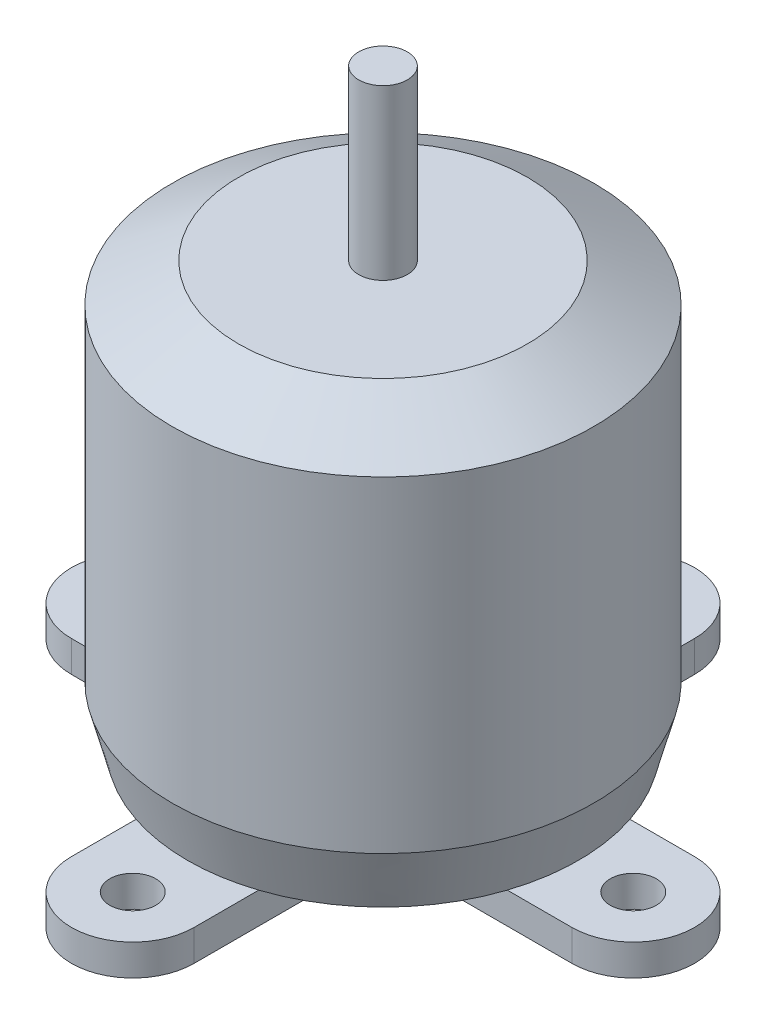
from build123d import *

# Parameters (mm, degrees)
SKETCH1_R           = 13.75
BOSS_EXTRUDE1_DEPTH = 27.5
SKETCH3_R           = 1.585
BOSS_EXTRUDE2_DEPTH = 11
CHAMFER1_SIZE       = 2.5
CHAMFER1_SIZE2      = 4.330127019
CHAMFER2_SIZE       = 1
CHAMFER2_SIZE2      = 3.732050808
SKETCH4_R           = 1.5
BOSS_EXTRUDE3_DEPTH = 2.032


with BuildPart() as part:
    # Sketch1 → Boss-Extrude1 (new body)
    with BuildSketch(Plane(origin=(0, 0, 0), x_dir=(1, 0, 0), z_dir=(0, 1, 0))):
        Circle(SKETCH1_R)
    extrude(amount=BOSS_EXTRUDE1_DEPTH)

    # Sketch3 → Boss-Extrude2 (add)
    with BuildSketch(Plane(origin=(0, 27.5, 0), x_dir=(1, 0, 0), z_dir=(0, 1, 0))):
        Circle(SKETCH3_R)
    extrude(amount=BOSS_EXTRUDE2_DEPTH)

    # Chamfer1
    chamfer1_edges = [part.edges().sort_by_distance(p)[0] for p in [
        (-13.75, 27.5, 0),
    ]]
    chamfer1_side = [part.faces().sort_by_distance(p)[0] for p in [
        (-13.75, 13.75, 0),
    ]]
    chamfer(chamfer1_edges, length=CHAMFER1_SIZE, length2=CHAMFER1_SIZE2, reference=chamfer1_side[0])

    # Chamfer2
    chamfer2_edges = [part.edges().sort_by_distance(p)[0] for p in [
        (-13.75, 0, 0),
    ]]
    chamfer2_side = [part.faces().sort_by_distance(p)[0] for p in [
        (0, 0, 0),
    ]]
    chamfer(chamfer2_edges, length=CHAMFER2_SIZE, length2=CHAMFER2_SIZE2, reference=chamfer2_side[0])

    # Sketch4 → Boss-Extrude3 (add)
    with BuildSketch(Plane.XZ):
        with BuildLine():
            Line((4, 16.32), (4, 9))
            ThreePointArc((4, 9), (5.464466094, 5.464466094), (9, 4))
            Line((9, 4), (16.32, 4))
            ThreePointArc((16.32, 4), (20.32, 0), (16.32, -4))
            Line((16.32, -4), (9, -4))
            ThreePointArc((9, -4), (5.464466094, -5.464466094), (4, -9))
            Line((4, -9), (4, -16.32))
            ThreePointArc((4, -16.32), (0, -20.32), (-4, -16.32))
            Line((-4, -16.32), (-4, -9))
            ThreePointArc((-4, -9), (-5.464466094, -5.464466094), (-9, -4))
            Line((-9, -4), (-16.32, -4))
            ThreePointArc((-16.32, -4), (-20.32, 0), (-16.32, 4))
            Line((-16.32, 4), (-9, 4))
            ThreePointArc((-9, 4), (-5.464466094, 5.464466094), (-4, 9))
            Line((-4, 9), (-4, 16.32))
            ThreePointArc((-4, 16.32), (0, 20.32), (4, 16.32))
        make_face()
        with Locations((0, 16.32)):
            Circle(SKETCH4_R, mode=Mode.SUBTRACT)
        with Locations((16.32, 0)):
            Circle(SKETCH4_R, mode=Mode.SUBTRACT)
        with Locations((0, -16.32)):
            Circle(SKETCH4_R, mode=Mode.SUBTRACT)
        with Locations((-16.32, 0)):
            Circle(SKETCH4_R, mode=Mode.SUBTRACT)
    extrude(amount=BOSS_EXTRUDE3_DEPTH)


solid = part.part
